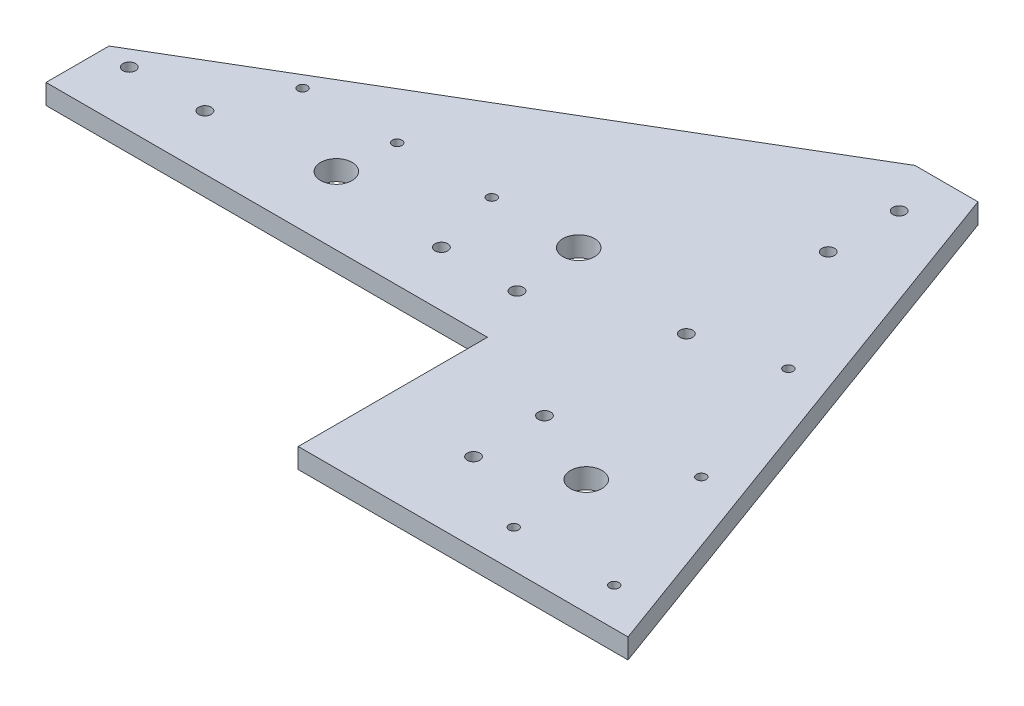
from build123d import *

# Parameters (mm, degrees)
SKETCH1_R           = 5
BOSS_EXTRUDE2_DEPTH = 6.35
SKETCH3_R           = 1.5
CUT_EXTRUDE1_DEPTH  = 6.35
SKETCH4_R           = 2
CUT_EXTRUDE2_DEPTH  = 10
SKETCH6_R           = 2
CUT_EXTRUDE3_DEPTH  = 6.35


with BuildPart() as part:
    # Sketch1 → Boss-Extrude2 (new body)
    with BuildSketch(Plane(origin=(0, 0, 0), x_dir=(1, 0, 0), z_dir=(0, 1, 0))):
        Polygon((180.6, 175), (160.6, 175), (0, 80), (0, 60), (70.5, 60), (140, 60), (140, 0), (194.75, 0), (244.6, 0), align=None)
        with Locations((194.75, 36.59)):
            Circle(SKETCH1_R, mode=Mode.SUBTRACT)
        with BuildLine():
            ThreePointArc((75.5, 81.59), (74.035533906, 78.054466094), (70.5, 76.59))
            ThreePointArc((70.5, 76.59), (66.964466094, 85.125533906), (75.5, 81.59))
        make_face(mode=Mode.SUBTRACT)
        with Locations((129.875, 99.09)):
            Circle(SKETCH1_R, mode=Mode.SUBTRACT)
    extrude(amount=BOSS_EXTRUDE2_DEPTH)

    # Sketch3 → Cut-Extrude1 (cut)
    with BuildSketch(Plane(origin=(0, 6.35, 0), x_dir=(1, 0, 0), z_dir=(0, 1, 0))):
        with Locations((42.27958751, 99.09440108)):
            Circle(SKETCH3_R)
        with Locations((196.359761891, 12)):
            Circle(SKETCH3_R)
        with Locations((228.211428571, 12)):
            Circle(SKETCH3_R)
        with Locations((212.285595231, 55.54720054)):
            Circle(SKETCH3_R)
        with Locations((196.359761891, 99.09440108)):
            Circle(SKETCH3_R)
        with Locations((102.27958751, 99.09440108)):
            Circle(SKETCH3_R)
        with Locations((72.27958751, 99.09440108)):
            Circle(SKETCH3_R)
    extrude(amount=-CUT_EXTRUDE1_DEPTH, mode=Mode.SUBTRACT)

    # Sketch4 → Cut-Extrude2 (cut)
    with BuildSketch(Plane(origin=(0, 6.35, 0), x_dir=(1, 0, 0), z_dir=(0, 1, 0))):
        with Locations((170.6, 160)):
            Circle(SKETCH4_R)
        with Locations((170.6, 25)):
            Circle(SKETCH4_R)
        with Locations((170.6, 47.5)):
            Circle(SKETCH4_R)
        with Locations((170.6, 92.5)):
            Circle(SKETCH4_R)
        with Locations((170.6, 137.5)):
            Circle(SKETCH4_R)
    extrude(amount=-CUT_EXTRUDE2_DEPTH, mode=Mode.SUBTRACT)

    # Sketch6 → Cut-Extrude3 (cut)
    with BuildSketch(Plane(origin=(0, 0, 0), x_dir=(-1, 0, 0), z_dir=(0, -1, 0))):
        with Locations((-132, 77.4)):
            Circle(SKETCH6_R)
        with Locations((-108, 77.4)):
            Circle(SKETCH6_R)
        with Locations((-33, 77.4)):
            Circle(SKETCH6_R)
        with Locations((-9, 77.4)):
            Circle(SKETCH6_R)
    extrude(amount=-CUT_EXTRUDE3_DEPTH, mode=Mode.SUBTRACT)


solid = part.part
